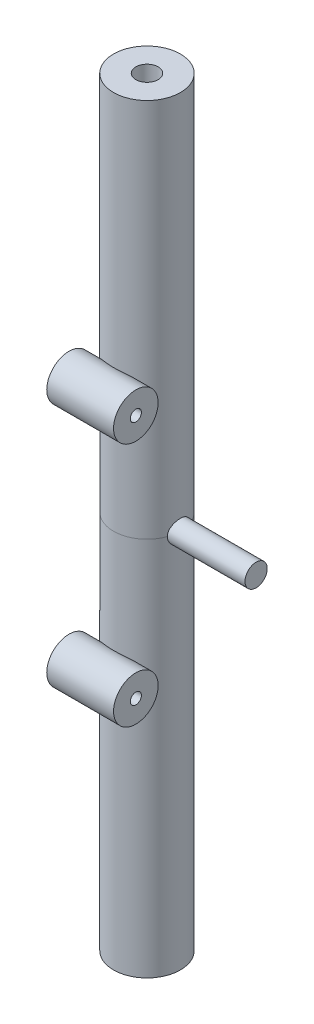
from build123d import *

# Parameters (mm, degrees)
SZKIC1_W                    = 20
SZKIC1_H                    = 682.34
SZKIC4_W                    = 60
SZKIC4_H                    = 15
SZKIC5_R                    = 10
DODANIE_WYCI_GNI_CIE1_DEPTH = 108


with BuildPart() as part:
    # Szkic1 → Obrót1 (revolve)
    with BuildSketch(Plane.XY):
        with Locations((-10, 217.294070703)):
            Rectangle(SZKIC1_W, SZKIC1_H)
    revolve(axis=Axis((10, 0, 0), (0, 1, 0)))

    # Szkic4 → Obrót2 (revolve)
    with BuildSketch(Plane.XY.offset(40)):
        with Locations((10, 94.794070703)):
            Rectangle(SZKIC4_W, SZKIC4_H)
    obr_t2 = revolve(axis=Axis((0, 107.294070703, 40), (1, 0, 0)))

    # Lustro1: Obrót2 across plane
    add(obr_t2.mirror(Plane(origin=(0, 217.294070703, 0), x_dir=(0, 0, 1), z_dir=(0, -1, 0))))


with BuildPart() as body_2:
    # Szkic5 → Dodanie-wyciągnięcie1 (new body)
    with BuildSketch(Plane(origin=(0, 0, 0), x_dir=(0, 0, -1), z_dir=(1, 0, 0))):
        with Locations((0, 217.294070703)):
            Circle(SZKIC5_R)
    extrude(amount=DODANIE_WYCI_GNI_CIE1_DEPTH)


solid = Compound([part.part, body_2.part])
